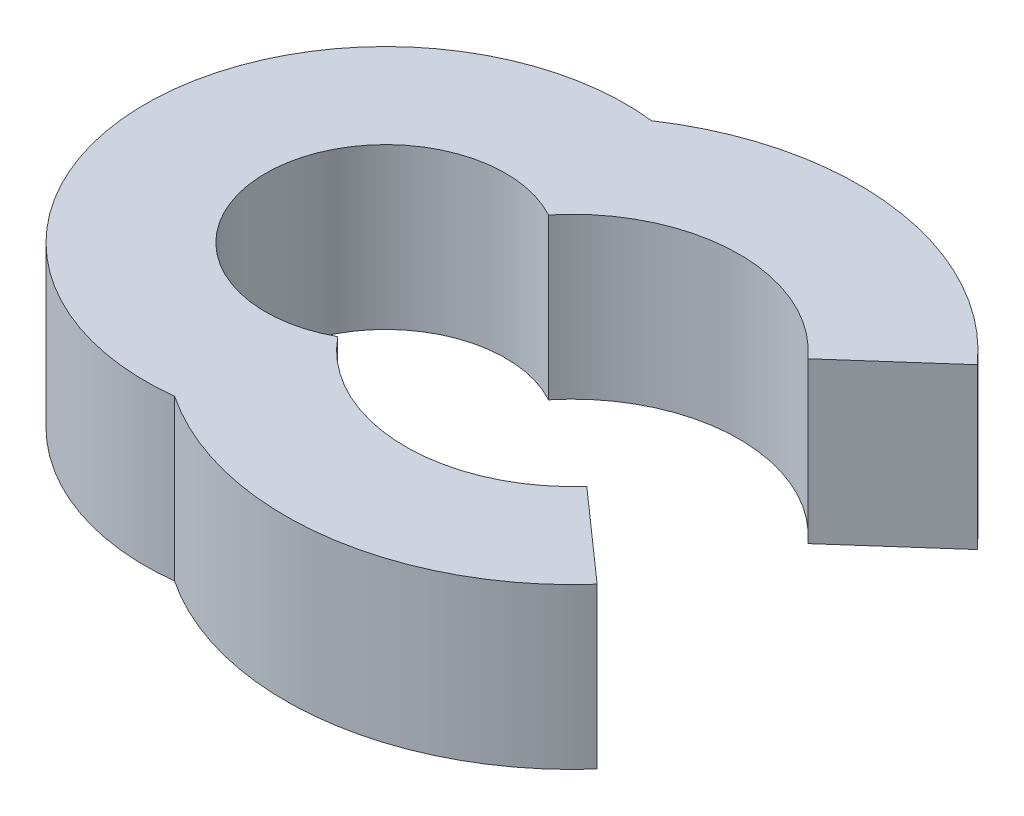
from build123d import *

# Parameters (mm, degrees)
BOSS_EXTRUDE1_DEPTH = 12


with BuildPart() as part:
    # Sketch1 → Boss-Extrude1 (new body)
    with BuildSketch(Plane(origin=(0, 0, 0), x_dir=(1, 0, 0), z_dir=(0, 1, 0))):
        with BuildLine():
            Line((9.36194651, 8.282750603), (16.102547997, 14.246331037))
            ThreePointArc((16.102547997, 14.246331037), (2.764131061, 21.321575445), (-11.9375, 17.881445516))
            ThreePointArc((-11.9375, 17.881445516), (-32, 0), (-11.9375, -17.881445516))
            ThreePointArc((-11.9375, -17.881445516), (2.764131061, -21.321575445), (16.102547997, -14.246331037))
            Line((16.102547997, -14.246331037), (9.36194651, -8.282750603))
            ThreePointArc((9.36194651, -8.282750603), (-0.251423093, -12.497471201), (-9.6875, -7.899515412))
            ThreePointArc((-9.6875, -7.899515412), (-23, 0), (-9.6875, 7.899515412))
            ThreePointArc((-9.6875, 7.899515412), (-0.251423093, 12.497471201), (9.36194651, 8.282750603))
        make_face()
    extrude(amount=-BOSS_EXTRUDE1_DEPTH)


solid = part.part
